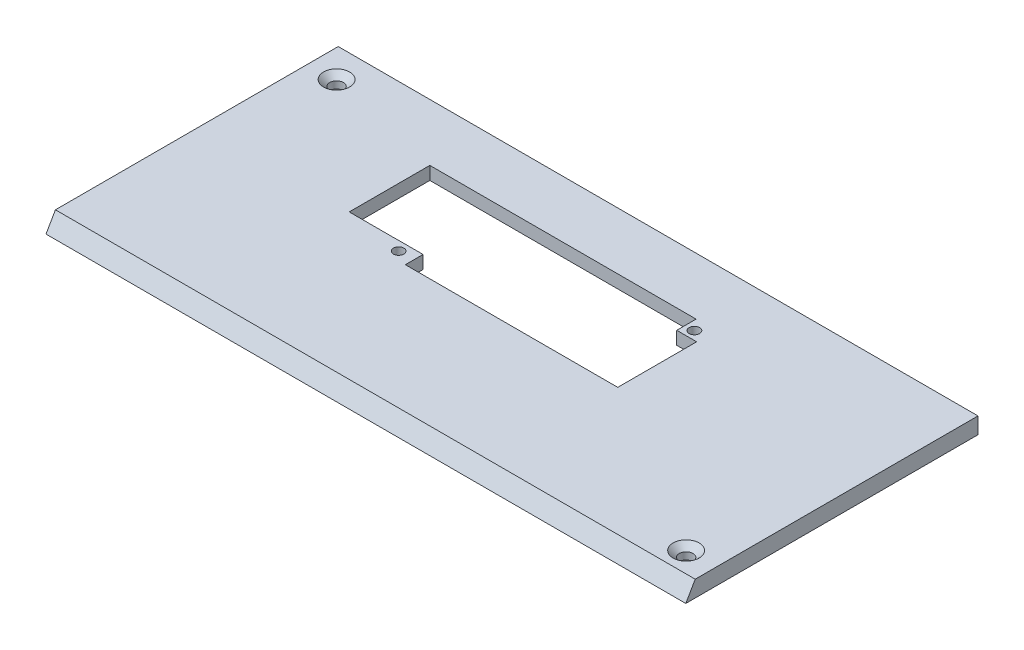
from build123d import *

# Parameters (mm, degrees)
SALIENTE_EXTRUIR1_DEPTH                              = 196
VACIADO1_T                                           = -4
SKETCH4_R                                            = 1.585
CUT_EXTRUDE3_DEPTH                                   = 13
AVELLANADO_PARA_TORNILLO_CON_CABEZA_AVEL_D           = 4.2
AVELLANADO_PARA_TORNILLO_CON_CABEZA_AVEL_DEPTH       = 10
AVELLANADO_PARA_TORNILLO_CON_CABEZA_AVEL_CSINK_D     = 8
AVELLANADO_PARA_TORNILLO_CON_CABEZA_AVEL_CSINK_ANGLE = 92
AVELLANADO_PARA_TORNILLO_CON_CABEZA_AVEL_TIP         = 1.2618073
SKETCH2_R                                            = 1.6
CUT_EXTRUDE4_DEPTH                                   = 10
SKETCH6_W                                            = 14.072347062
SKETCH6_H                                            = 24.69332823
CUT_EXTRUDE5_DEPTH                                   = 10


with BuildPart() as part:
    # Croquis1 → Saliente-Extruir1 (new body)
    with BuildSketch(Plane(origin=(0, 0, 0), x_dir=(0, 0, -1), z_dir=(1, 0, 0))):
        Polygon((0, 0), (89.52, 0), (89.52, 5), (2.886751346, 5), align=None)
    extrude(amount=SALIENTE_EXTRUIR1_DEPTH)

    # Vaciado1
    vaciado1_openings = [part.faces().sort_by_distance(p)[0] for p in [
        (98, 0, -44.76),
    ]]
    offset(amount=VACIADO1_T, openings=vaciado1_openings, kind=Kind.INTERSECTION)

    # Sketch4 → Cut-Extrude3 (cut)
    with BuildSketch(Plane(origin=(0, 1, 0), x_dir=(-1, 0, 0), z_dir=(0, -1, 0))):
        with Locations((-8.5, 80.52)):
            Circle(SKETCH4_R)
        with Locations((-187, 9.110852167)):
            Circle(SKETCH4_R)
    extrude(amount=-CUT_EXTRUDE3_DEPTH, mode=Mode.SUBTRACT)

    # Avellanado para tornillo con cabeza avellanada en cruz de M3.51
    with Locations(Plane(origin=(187, 5, -9.110852167), x_dir=(0, 0, 1), z_dir=(0, 1, 0))):
        with Locations((0, 0), (-71.409147833, -178.5)):
            CounterSinkHole(AVELLANADO_PARA_TORNILLO_CON_CABEZA_AVEL_D / 2, AVELLANADO_PARA_TORNILLO_CON_CABEZA_AVEL_CSINK_D / 2, depth=AVELLANADO_PARA_TORNILLO_CON_CABEZA_AVEL_DEPTH, counter_sink_angle=AVELLANADO_PARA_TORNILLO_CON_CABEZA_AVEL_CSINK_ANGLE)
            with Locations((0, 0, -(AVELLANADO_PARA_TORNILLO_CON_CABEZA_AVEL_DEPTH + AVELLANADO_PARA_TORNILLO_CON_CABEZA_AVEL_TIP / 2))):  # 118° drill point
                Cone(0, AVELLANADO_PARA_TORNILLO_CON_CABEZA_AVEL_D / 2, AVELLANADO_PARA_TORNILLO_CON_CABEZA_AVEL_TIP, mode=Mode.SUBTRACT)

    # Sketch2 → Cut-Extrude4 (cut)
    with BuildSketch(Plane(origin=(0, 1, 0), x_dir=(-1, 0, 0), z_dir=(0, -1, 0))):
        with Locations((-63.52688968, 44.506716839)):
            Circle(SKETCH2_R)
        with Locations((-129.916866124, 68.723012087)):
            Circle(SKETCH2_R)
        Polygon((-59.63721676, 47.355101101), (-68.161474477, 47.355101101), (-68.161474477, 41.923012087), (-133.236866124, 41.923012087), (-133.236866124, 66.093328063), (-127.135158107, 66.093328063), (-127.135158107, 72.023012087), (-59.63721676, 72.023012087), align=None)
    extrude(amount=-CUT_EXTRUDE4_DEPTH, mode=Mode.SUBTRACT)

    # Sketch6 → Cut-Extrude5 (cut)
    with BuildSketch(Plane(origin=(0, 5, 0), x_dir=(1, 0, 0), z_dir=(0, 1, 0))):
        with Locations((52.601043229, 59.676347972)):
            Rectangle(SKETCH6_W, SKETCH6_H)
    extrude(amount=-CUT_EXTRUDE5_DEPTH, mode=Mode.SUBTRACT)


solid = part.part
